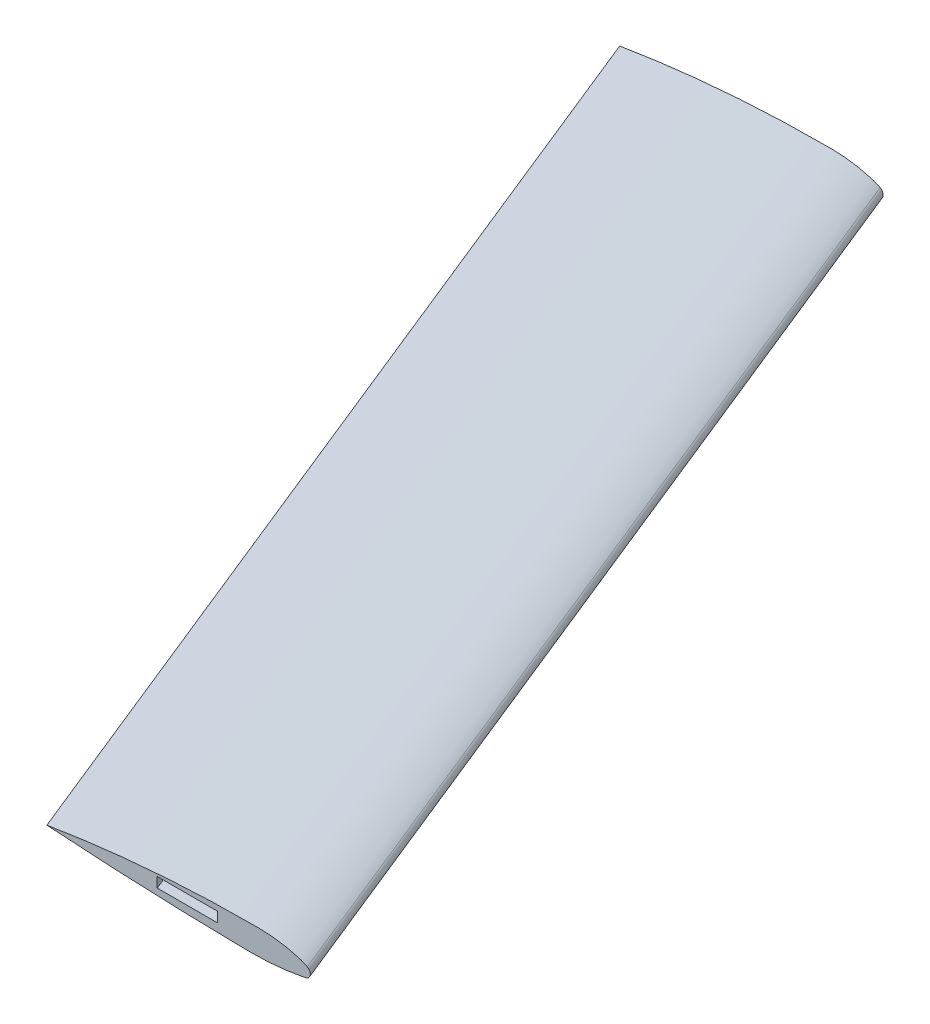
from build123d import *

# Parameters (mm, degrees)
FILLET1_R          = 6.35
CUT_EXTRUDE1_DEPTH = 5.715


with BuildPart() as part:
    # Loft1: read off the stored shape, not the designer's step
    # Loft1: loft between two sections, ruled curve by curve
    loft1_from = [
        Edge.make_bspline([(24.279187945, 3.948004614, 0), (-52.181559212, 4.916545658, 0), (-128.070307753, 8.018651666, 0), (-204.294256369, 13.29140622, 0)], [0, 0, 0, 0, 1, 1, 1, 1], 3),
        Edge.make_bspline([(-204.294256369, 13.29140622, 0), (-184.369512206, 16.572994832, 0), (-144.381846874, 22.297046923, 0), (-84.092880853, 28.357796113, 0), (-23.602992188, 31.887748815, 0), (16.786735513, 32.551722112, 0), (40.744531167, 32.444363464, 0), (48.273002024, 32.147159251, 0), (59.506847478, 30.912047149, 0), (70.62623515, 28.890794317, 0), (77.925454281, 27.022710847, 0), (83.579383211, 25.35880292, 0), (87.594175743, 23.919756171, 0), (93.32072474, 21.066871392, 0), (98.662526007, 17.544862079, 0), (101.906485619, 14.774278592, 0), (103.433890649, 13.29140622, 0)], [0, 0, 0, 0, 0.193518653, 0.387037305, 0.580555958, 0.774074611, 0.774074611, 0.810154684, 0.846234756, 0.882314829, 0.918394902, 0.918394902, 0.938796176, 0.959197451, 0.979598725, 1, 1, 1, 1], 3),
        Edge.make_bspline([(103.433890649, 13.29140622, 0), (77.651903075, 6.754833934, 0), (51.005185394, 3.609461944, 0), (24.279187945, 3.948004614, 0)], [0, 0, 0, 0, 1, 1, 1, 1], 3),
    ]
    loft1_to = [
        Edge.make_bspline([(-416.997552056, 3.948004614, -1092.2), (-493.458299212, 4.916545658, -1092.2), (-569.347047753, 8.018651666, -1092.2), (-645.570996369, 13.29140622, -1092.2)], [0, 0, 0, 0, 1, 1, 1, 1], 3),
        Edge.make_bspline([(-645.570996369, 13.29140622, -1092.2), (-625.646252206, 16.572994832, -1092.2), (-585.658586874, 22.297046923, -1092.2), (-525.369620853, 28.357796113, -1092.2), (-464.879732188, 31.887748815, -1092.2), (-424.490004487, 32.551722112, -1092.2), (-400.532208833, 32.444363464, -1092.2), (-393.003737976, 32.147159251, -1092.2), (-381.769892522, 30.912047149, -1092.2), (-370.65050485, 28.890794317, -1092.2), (-363.351285719, 27.022710847, -1092.2), (-357.697356789, 25.35880292, -1092.2), (-353.682564257, 23.919756171, -1092.2), (-347.95601526, 21.066871392, -1092.2), (-342.614213993, 17.544862079, -1092.2), (-339.370254381, 14.774278592, -1092.2), (-337.842849351, 13.29140622, -1092.2)], [0, 0, 0, 0, 0.193518653, 0.387037305, 0.580555958, 0.774074611, 0.774074611, 0.810154684, 0.846234756, 0.882314829, 0.918394902, 0.918394902, 0.938796176, 0.959197451, 0.979598725, 1, 1, 1, 1], 3),
        Edge.make_bspline([(-337.842849351, 13.29140622, -1092.2), (-363.624836925, 6.754833934, -1092.2), (-390.271554606, 3.609461944, -1092.2), (-416.997552056, 3.948004614, -1092.2)], [0, 0, 0, 0, 1, 1, 1, 1], 3),
    ]
    loft1 = Solid(Shell([*[Face.make_surface_from_curves(loft1_from[k], loft1_to[k]) for k in range(3)], Face(Wire(loft1_from)), Face(Wire(loft1_to))]))
    add(loft1)

    # Fillet1
    fillet1_edges = [part.edges().sort_by_distance(p)[0] for p in [
        (-117.204479351, 13.29140622, -546.1),
    ]]
    fillet(fillet1_edges, radius=FILLET1_R)

    # Sketch10 → Cut-Extrude1 (cut, symmetric)
    with BuildSketch(Plane(origin=(0, 19.812, 0), x_dir=(1, 0, 0), z_dir=(0, 1, 0))):
        Polygon((-451.642700268, 1092.2), (-10.365256411, 0), (-78.852212571, 0), (-520.129656429, 1092.2), align=None)
    extrude(amount=CUT_EXTRUDE1_DEPTH, both=True, mode=Mode.SUBTRACT)


solid = part.part
